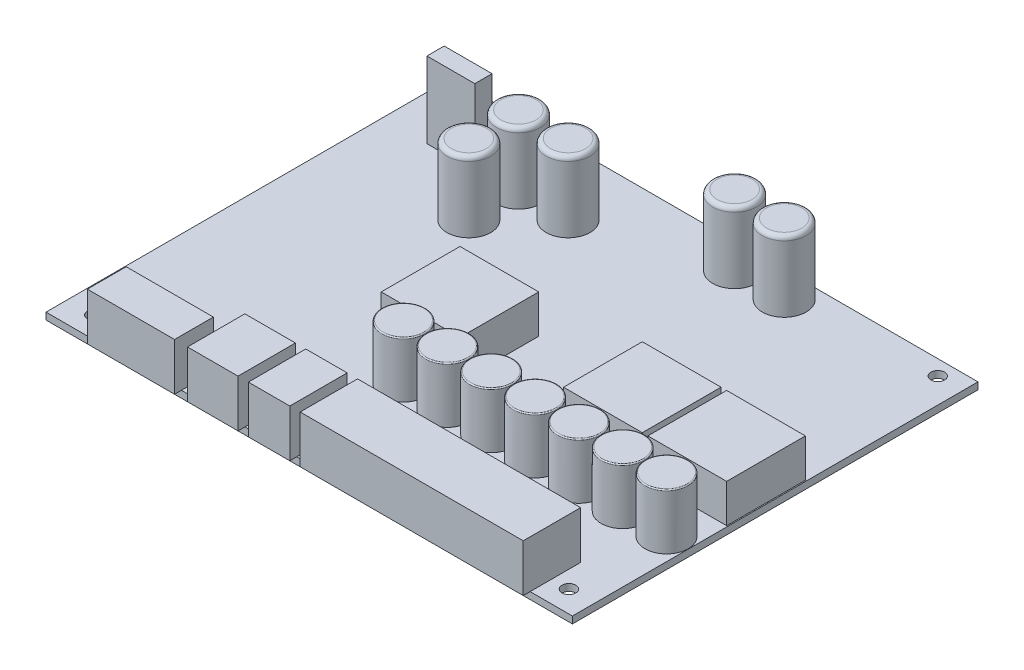
from build123d import *

# Parameters (mm, degrees)
SKETCH1_W              = 122
SKETCH1_H              = 94
BOSS_EXTRUDE1_DEPTH    = 1.6
SKETCH2_R              = 1.585
CUT_EXTRUDE1_DEPTH     = 78.023113414
SKETCH3_R              = 5.085
BOSS_EXTRUDE2_DEPTH    = 16.35
FILLET1_R              = 1.016
SKETCH4_R              = 5
BOSS_EXTRUDE3_DEPTH    = 12.9
FILLET2_R              = 0.254
LPATTERN1_COUNT        = 7
LPATTERN1_PITCH        = 10.16
FILLET2_OF_LPATTERN1_R = 0.254
SKETCH5_W              = 18.25
SKETCH5_H              = 18.25
BOSS_EXTRUDE4_DEPTH    = 8.9
SKETCH6_W              = 11.1
SKETCH6_H              = 4
BOSS_EXTRUDE5_DEPTH    = 17.6
SKETCH7_W              = 20.2
SKETCH7_H              = 9
SKETCH7_W_2            = 11.709999948
SKETCH7_H_2            = 13.3
SKETCH7_W_3            = 9.6
SKETCH7_W_4            = 51.699999978
BOSS_EXTRUDE6_DEPTH    = 11


with BuildPart() as part:
    # Sketch1 → Boss-Extrude1 (new body)
    with BuildSketch(Plane(origin=(0, 0, 0), x_dir=(1, 0, 0), z_dir=(0, 1, 0))):
        Rectangle(SKETCH1_W, SKETCH1_H)
    extrude(amount=BOSS_EXTRUDE1_DEPTH)

    # Sketch2 → Cut-Extrude1 (cut, through all)
    with BuildSketch(Plane(origin=(0, 1.6, 0), x_dir=(1, 0, 0), z_dir=(0, 1, 0))):
        with Locations((-54.82, 43.5)):
            Circle(SKETCH2_R)
        with Locations((55.18, 43.5)):
            Circle(SKETCH2_R)
        with Locations((55.18, -42)):
            Circle(SKETCH2_R)
        with Locations((-54.82, -42)):
            Circle(SKETCH2_R)
    extrude(amount=-CUT_EXTRUDE1_DEPTH, mode=Mode.SUBTRACT)

    # Sketch3 → Boss-Extrude2 (add)
    with BuildSketch(Plane(origin=(0, 1.6, 0), x_dir=(1, 0, 0), z_dir=(0, 1, 0))):
        with Locations((22, 41.089465704)):
            Circle(SKETCH3_R)
        with Locations((10.5, 41.089465704)):
            Circle(SKETCH3_R)
        with Locations((-19, 32)):
            Circle(SKETCH3_R)
        with Locations((-30.5, 32)):
            Circle(SKETCH3_R)
        with Locations((-30.5, 20.5)):
            Circle(SKETCH3_R)
    extrude(amount=BOSS_EXTRUDE2_DEPTH)

    # Fillet1
    fillet1_edges = [part.edges().sort_by_distance(p)[0] for p in [
        (-35.585, 17.95, -20.5),
        (-35.585, 17.95, -32),
        (-24.085, 17.95, -32),
        (5.415, 17.95, -41.089465704),
        (16.915, 17.95, -41.089465704),
    ]]
    fillet(fillet1_edges, radius=FILLET1_R)

    # Sketch4 → Boss-Extrude3 (add)
    with BuildSketch(Plane(origin=(0, 1.6, 0), x_dir=(1, 0, 0), z_dir=(0, 1, 0))):
        with Locations((55.92, -20.1)):
            Circle(SKETCH4_R)
    boss_extrude3 = extrude(amount=BOSS_EXTRUDE3_DEPTH)

    # Fillet2
    fillet2_edges = [part.edges().sort_by_distance(p)[0] for p in [
        (50.92, 14.5, 20.1),
    ]]
    fillet(fillet2_edges, radius=FILLET2_R)

    # LPattern1: Boss-Extrude3 ×7
    with Locations(*[(-i * LPATTERN1_PITCH, 0, 0) for i in range(1, LPATTERN1_COUNT)]):
        add(boss_extrude3)

    # Fillet2 of LPattern1
    fillet2_of_lpattern1_edges = [part.edges().sort_by_distance(p)[0] for p in [
        (40.76, 14.5, 20.1),
        (30.6, 14.5, 20.1),
        (20.44, 14.5, 20.1),
        (10.28, 14.5, 20.1),
        (0.12, 14.5, 20.1),
        (-10.04, 14.5, 20.1),
    ]]
    fillet(fillet2_of_lpattern1_edges, radius=FILLET2_OF_LPATTERN1_R)

    # Sketch5 → Boss-Extrude4 (add)
    with BuildSketch(Plane(origin=(0, 1.6, 0), x_dir=(1, 0, 0), z_dir=(0, 1, 0))):
        with Locations((51.621, -1.875)):
            Rectangle(SKETCH5_W, SKETCH5_H)
        with Locations((32.071, -1.875)):
            Rectangle(SKETCH5_W, SKETCH5_H)
        with Locations((-8.179, -3.875)):
            Rectangle(SKETCH5_W, SKETCH5_H)
    extrude(amount=BOSS_EXTRUDE4_DEPTH)

    # Sketch6 → Boss-Extrude5 (add)
    with BuildSketch(Plane(origin=(0, 1.6, 0), x_dir=(1, 0, 0), z_dir=(0, 1, 0))):
        with Locations((-45.115858771, 32.945131729)):
            Rectangle(SKETCH6_W, SKETCH6_H)
    extrude(amount=BOSS_EXTRUDE5_DEPTH)

    # Sketch7 → Boss-Extrude6 (add)
    with BuildSketch(Plane(origin=(0, 1.6, 0), x_dir=(1, 0, 0), z_dir=(0, 1, 0))):
        with Locations((-39.709999884, -44.1)):
            Rectangle(SKETCH7_W, SKETCH7_H)
        with Locations((-20.75499991, -41.95)):
            Rectangle(SKETCH7_W_2, SKETCH7_H_2)
        with Locations((-7.699999936, -41.95)):
            Rectangle(SKETCH7_W_3, SKETCH7_H_2)
        with Locations((25.350000053, -41.95)):
            Rectangle(SKETCH7_W_4, SKETCH7_H_2)
    extrude(amount=BOSS_EXTRUDE6_DEPTH)


solid = part.part
